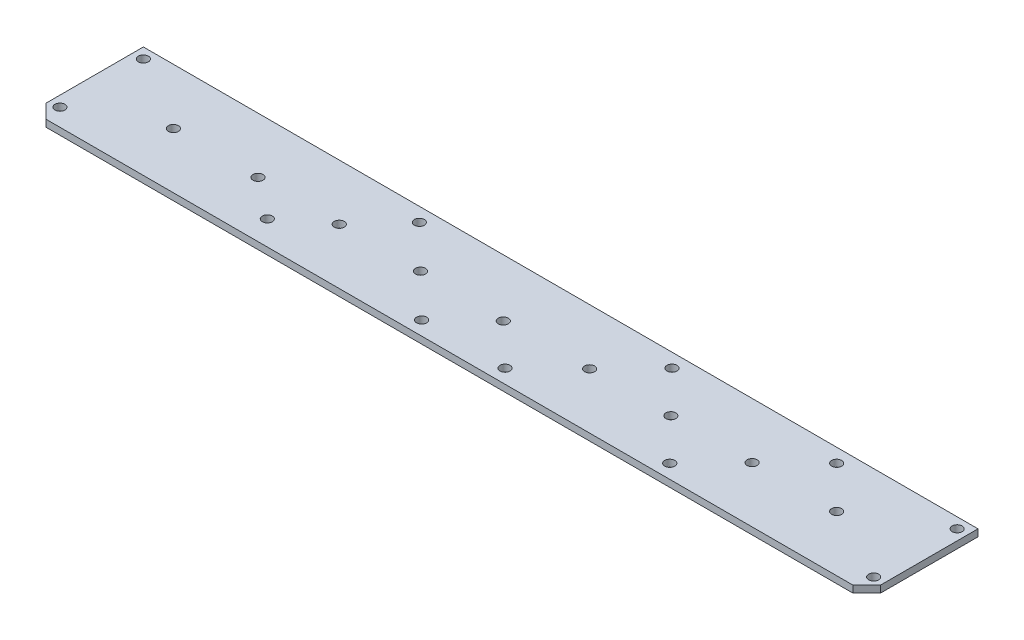
from build123d import *

# Parameters (mm, degrees)
SKETCH2_W           = 381
SKETCH2_H           = 50.8
BOSS_EXTRUDE1_DEPTH = 3.175
SKETCH3_R           = 2.286
CUT_EXTRUDE1_DEPTH  = 385.384860036


with BuildPart() as part:
    # Sketch2 → Boss-Extrude1 (new body)
    with BuildSketch(Plane(origin=(0, 0, 0), x_dir=(1, 0, 0), z_dir=(0, 1, 0))):
        with Locations((190.5, 25.4)):
            Rectangle(SKETCH2_W, SKETCH2_H)
    extrude(amount=BOSS_EXTRUDE1_DEPTH)

    # Sketch3 → Cut-Extrude1 (cut, through all)
    with BuildSketch(Plane(origin=(0, 0, 0), x_dir=(1, 0, 0), z_dir=(0, 1, 0))):
        with Locations((96.266, 11.1125)):
            Circle(SKETCH3_R)
        with Locations((284.734, 6.35)):
            Circle(SKETCH3_R)
        with Locations((322.834, 44.45)):
            Circle(SKETCH3_R)
        with Locations((132.334, 44.45)):
            Circle(SKETCH3_R)
        with Locations((247.65, 44.45)):
            Circle(SKETCH3_R)
        with Locations((209.55, 6.35)):
            Circle(SKETCH3_R)
        with Locations((171.45, 6.35)):
            Circle(SKETCH3_R)
        with Locations((4.7625, 7.9375)):
            Circle(SKETCH3_R)
        with Locations((4.7625, 46.0375)):
            Circle(SKETCH3_R)
        with Locations((39.116, 25.4)):
            Circle(SKETCH3_R)
        with Locations((77.724, 25.4)):
            Circle(SKETCH3_R)
        with Locations((114.808, 25.4)):
            Circle(SKETCH3_R)
        with Locations((190.5, 24.60625)):
            Circle(SKETCH3_R)
        with Locations((341.884, 25.4)):
            Circle(SKETCH3_R)
        with Locations((376.2375, 7.9375)):
            Circle(SKETCH3_R)
        with Locations((376.2375, 46.0375)):
            Circle(SKETCH3_R)
        with Locations((303.276, 25.4)):
            Circle(SKETCH3_R)
        with Locations((266.192, 25.4)):
            Circle(SKETCH3_R)
        with Locations((229.108, 25.4)):
            Circle(SKETCH3_R)
        with Locations((151.892, 25.4)):
            Circle(SKETCH3_R)
        Polygon((0, 6.35), (6.35, 0), (0, 0), align=None)
        Polygon((374.65, 0), (381, 6.35), (381, 0), align=None)
    extrude(amount=CUT_EXTRUDE1_DEPTH, mode=Mode.SUBTRACT)


solid = part.part
